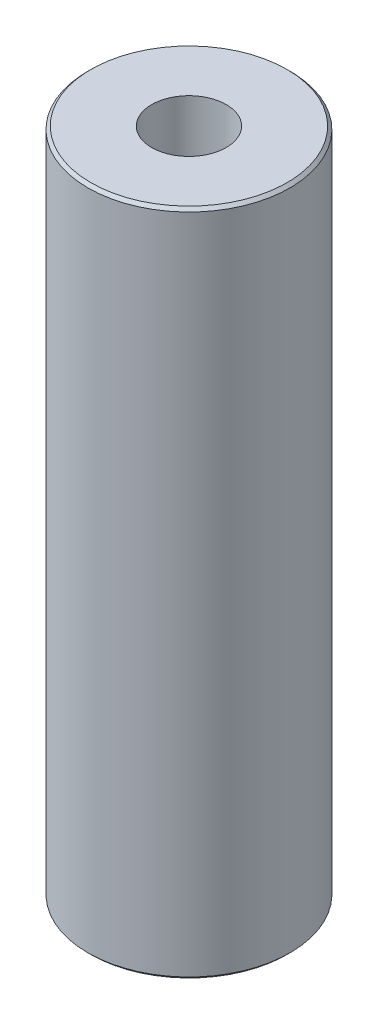
from build123d import *

# Parameters (mm, degrees)
SKETCH1_R           = 60
BOSS_EXTRUDE1_DEPTH = 396.776497742
SKETCH2_R           = 22.115309307
CUT_EXTRUDE1_DEPTH  = 406.748184421
CHAMFER1_SIZE       = 1.781488051


with BuildPart() as part:
    # Sketch1 → Boss-Extrude1 (new body)
    with BuildSketch(Plane(origin=(0, 0, 0), x_dir=(1, 0, 0), z_dir=(0, 1, 0))):
        Circle(SKETCH1_R)
    extrude(amount=BOSS_EXTRUDE1_DEPTH)

    # Sketch2 → Cut-Extrude1 (cut, through all)
    with BuildSketch(Plane(origin=(0, 0, 0), x_dir=(1, 0, 0), z_dir=(0, 1, 0))):
        Circle(SKETCH2_R)
    extrude(amount=CUT_EXTRUDE1_DEPTH, mode=Mode.SUBTRACT)

    # Chamfer1
    chamfer1_edges = [part.edges().sort_by_distance(p)[0] for p in [
        (-60, 396.776497742, 0),
        (-60, 0, 0),
    ]]
    chamfer(chamfer1_edges, length=CHAMFER1_SIZE)


solid = part.part
